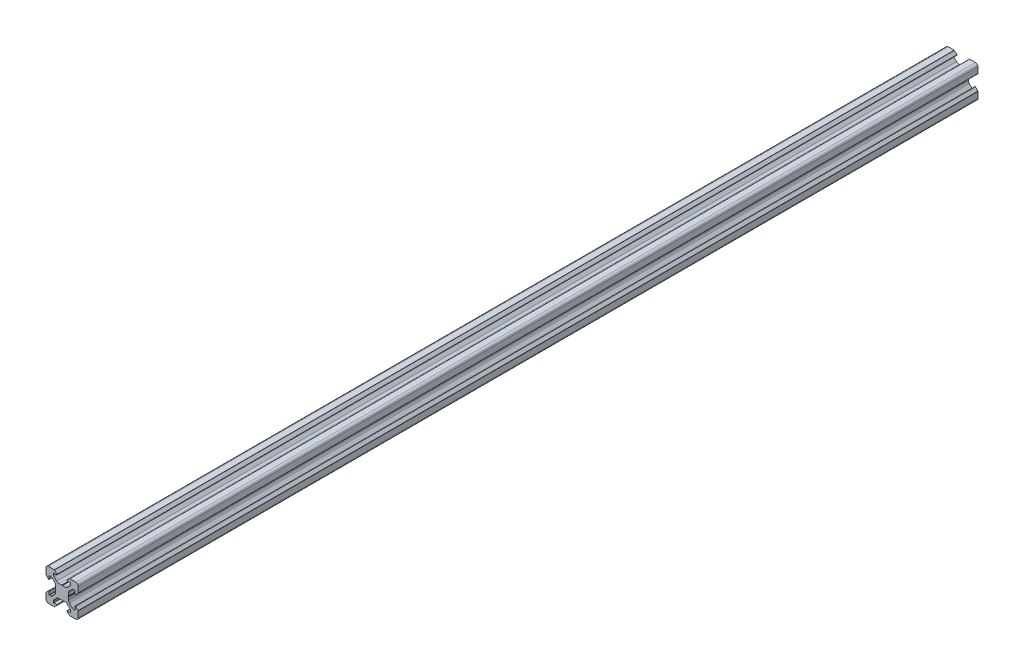
from build123d import *

# Parameters (mm, degrees)
EXTRUDE_1_DEPTH = 560


# Read off the part's stored shape, not the designer's step: 222 Конструкционный профиль 20х20-1-surface1
with BuildPart() as part:
    # Эскиз1 → Бобышка-Вытянуть1 (new body)
    with BuildSketch(Plane.XY):
        with BuildLine():
            Line((-3.945217202, 0.181521503), (-3.8, 0))
            Line((-3.8, 0), (-3.945217202, -0.181521503))
            ThreePointArc((-3.945217202, -0.181521503), (-3.98590708, -0.254943529), (-4, -0.337695265))
            Line((-4, -0.337695265), (-4, -1.898780669))
            ThreePointArc((-4, -1.898780669), (-4.152240935, -2.664147534), (-4.585786438, -3.312994231))
            Line((-4.585786438, -3.312994231), (-6.279898987, -5.007106781))
            ThreePointArc((-6.279898987, -5.007106781), (-6.604322336, -5.223879533), (-6.987005769, -5.3))
            Line((-6.987005769, -5.3), (-7.8, -5.3))
            ThreePointArc((-7.8, -5.3), (-7.941421356, -5.241421356), (-8, -5.1))
            Line((-8, -5.1), (-8, -3.33))
            ThreePointArc((-8, -3.33), (-8.154329142, -3.099030117), (-8.426776695, -3.153223305))
            Line((-8.426776695, -3.153223305), (-9.926776695, -4.653223305))
            ThreePointArc((-9.926776695, -4.653223305), (-9.980969883, -4.734329142), (-10, -4.83))
            Line((-10, -4.83), (-10, -8.5))
            ThreePointArc((-10, -8.5), (-9.560660172, -9.560660172), (-8.5, -10))
            Line((-8.5, -10), (-4.83, -10))
            ThreePointArc((-4.83, -10), (-4.734329142, -9.980969883), (-4.653223305, -9.926776695))
            Line((-4.653223305, -9.926776695), (-3.153223305, -8.426776695))
            ThreePointArc((-3.153223305, -8.426776695), (-3.099030117, -8.154329142), (-3.33, -8))
            Line((-3.33, -8), (-5.1, -8))
            ThreePointArc((-5.1, -8), (-5.241421356, -7.941421356), (-5.3, -7.8))
            Line((-5.3, -7.8), (-5.3, -6.987005769))
            ThreePointArc((-5.3, -6.987005769), (-5.223879533, -6.604322336), (-5.007106781, -6.279898987))
            Line((-5.007106781, -6.279898987), (-3.312994231, -4.585786438))
            ThreePointArc((-3.312994231, -4.585786438), (-2.664147534, -4.152240935), (-1.898780669, -4))
            Line((-1.898780669, -4), (-0.337695265, -4))
            ThreePointArc((-0.337695265, -4), (-0.254943529, -3.98590708), (-0.181521503, -3.945217202))
            Line((-0.181521503, -3.945217202), (0, -3.8))
            Line((0, -3.8), (0.181521503, -3.945217202))
            ThreePointArc((0.181521503, -3.945217202), (0.254943529, -3.98590708), (0.337695265, -4))
            Line((0.337695265, -4), (1.898780669, -4))
            ThreePointArc((1.898780669, -4), (2.664147534, -4.152240935), (3.312994231, -4.585786438))
            Line((3.312994231, -4.585786438), (5.007106781, -6.279898987))
            ThreePointArc((5.007106781, -6.279898987), (5.223879533, -6.604322336), (5.3, -6.987005769))
            Line((5.3, -6.987005769), (5.3, -7.8))
            ThreePointArc((5.3, -7.8), (5.241421356, -7.941421356), (5.1, -8))
            Line((5.1, -8), (3.33, -8))
            ThreePointArc((3.33, -8), (3.099030117, -8.154329142), (3.153223305, -8.426776695))
            Line((3.153223305, -8.426776695), (4.653223305, -9.926776695))
            ThreePointArc((4.653223305, -9.926776695), (4.734329142, -9.980969883), (4.83, -10))
            Line((4.83, -10), (8.5, -10))
            ThreePointArc((8.5, -10), (9.560660172, -9.560660172), (10, -8.5))
            Line((10, -8.5), (10, -4.83))
            ThreePointArc((10, -4.83), (9.980969883, -4.734329142), (9.926776695, -4.653223305))
            Line((9.926776695, -4.653223305), (8.426776695, -3.153223305))
            ThreePointArc((8.426776695, -3.153223305), (8.154329142, -3.099030117), (8, -3.33))
            Line((8, -3.33), (8, -5.1))
            ThreePointArc((8, -5.1), (7.941421356, -5.241421356), (7.8, -5.3))
            Line((7.8, -5.3), (6.987005769, -5.3))
            ThreePointArc((6.987005769, -5.3), (6.604322336, -5.223879533), (6.279898987, -5.007106781))
            Line((6.279898987, -5.007106781), (4.585786438, -3.312994231))
            ThreePointArc((4.585786438, -3.312994231), (4.152240935, -2.664147534), (4, -1.898780669))
            Line((4, -1.898780669), (4, -0.337695265))
            ThreePointArc((4, -0.337695265), (3.98590708, -0.254943529), (3.945217202, -0.181521503))
            Line((3.945217202, -0.181521503), (3.8, 0))
            Line((3.8, 0), (3.945217202, 0.181521503))
            ThreePointArc((3.945217202, 0.181521503), (3.98590708, 0.254943529), (4, 0.337695265))
            Line((4, 0.337695265), (4, 1.898780669))
            ThreePointArc((4, 1.898780669), (4.152240935, 2.664147534), (4.585786438, 3.312994231))
            Line((4.585786438, 3.312994231), (6.279898987, 5.007106781))
            ThreePointArc((6.279898987, 5.007106781), (6.604322336, 5.223879533), (6.987005769, 5.3))
            Line((6.987005769, 5.3), (7.8, 5.3))
            ThreePointArc((7.8, 5.3), (7.941421356, 5.241421356), (8, 5.1))
            Line((8, 5.1), (8, 3.33))
            ThreePointArc((8, 3.33), (8.154329142, 3.099030117), (8.426776695, 3.153223305))
            Line((8.426776695, 3.153223305), (9.926776695, 4.653223305))
            ThreePointArc((9.926776695, 4.653223305), (9.980969883, 4.734329142), (10, 4.83))
            Line((10, 4.83), (10, 8.5))
            ThreePointArc((10, 8.5), (9.560660172, 9.560660172), (8.5, 10))
            Line((8.5, 10), (4.83, 10))
            ThreePointArc((4.83, 10), (4.734329142, 9.980969883), (4.653223305, 9.926776695))
            Line((4.653223305, 9.926776695), (3.153223305, 8.426776695))
            ThreePointArc((3.153223305, 8.426776695), (3.099030117, 8.154329142), (3.33, 8))
            Line((3.33, 8), (5.1, 8))
            ThreePointArc((5.1, 8), (5.241421356, 7.941421356), (5.3, 7.8))
            Line((5.3, 7.8), (5.3, 6.987005769))
            ThreePointArc((5.3, 6.987005769), (5.223879533, 6.604322336), (5.007106781, 6.279898987))
            Line((5.007106781, 6.279898987), (3.312994231, 4.585786438))
            ThreePointArc((3.312994231, 4.585786438), (2.664147534, 4.152240935), (1.898780669, 4))
            Line((1.898780669, 4), (0.337695265, 4))
            ThreePointArc((0.337695265, 4), (0.254943529, 3.98590708), (0.181521503, 3.945217202))
            Line((0.181521503, 3.945217202), (0, 3.8))
            Line((0, 3.8), (-0.181521503, 3.945217202))
            ThreePointArc((-0.181521503, 3.945217202), (-0.254943529, 3.98590708), (-0.337695265, 4))
            Line((-0.337695265, 4), (-1.898780669, 4))
            ThreePointArc((-1.898780669, 4), (-2.664147534, 4.152240935), (-3.312994231, 4.585786438))
            Line((-3.312994231, 4.585786438), (-5.007106781, 6.279898987))
            ThreePointArc((-5.007106781, 6.279898987), (-5.223879533, 6.604322336), (-5.3, 6.987005769))
            Line((-5.3, 6.987005769), (-5.3, 7.8))
            ThreePointArc((-5.3, 7.8), (-5.241421356, 7.941421356), (-5.1, 8))
            Line((-5.1, 8), (-3.33, 8))
            ThreePointArc((-3.33, 8), (-3.099030117, 8.154329142), (-3.153223305, 8.426776695))
            Line((-3.153223305, 8.426776695), (-4.653223305, 9.926776695))
            ThreePointArc((-4.653223305, 9.926776695), (-4.734329142, 9.980969883), (-4.83, 10))
            Line((-4.83, 10), (-8.5, 10))
            ThreePointArc((-8.5, 10), (-9.560660172, 9.560660172), (-10, 8.5))
            Line((-10, 8.5), (-10, 4.83))
            ThreePointArc((-10, 4.83), (-9.980969883, 4.734329142), (-9.926776695, 4.653223305))
            Line((-9.926776695, 4.653223305), (-8.426776695, 3.153223305))
            ThreePointArc((-8.426776695, 3.153223305), (-8.154329142, 3.099030117), (-8, 3.33))
            Line((-8, 3.33), (-8, 5.1))
            ThreePointArc((-8, 5.1), (-7.941421356, 5.241421356), (-7.8, 5.3))
            Line((-7.8, 5.3), (-6.987005769, 5.3))
            ThreePointArc((-6.987005769, 5.3), (-6.604322336, 5.223879533), (-6.279898987, 5.007106781))
            Line((-6.279898987, 5.007106781), (-4.585786438, 3.312994231))
            ThreePointArc((-4.585786438, 3.312994231), (-4.152240935, 2.664147534), (-4, 1.898780669))
            Line((-4, 1.898780669), (-4, 0.337695265))
            ThreePointArc((-4, 0.337695265), (-3.98590708, 0.254943529), (-3.945217202, 0.181521503))
        make_face()
    extrude(amount=EXTRUDE_1_DEPTH)


solid = part.part
